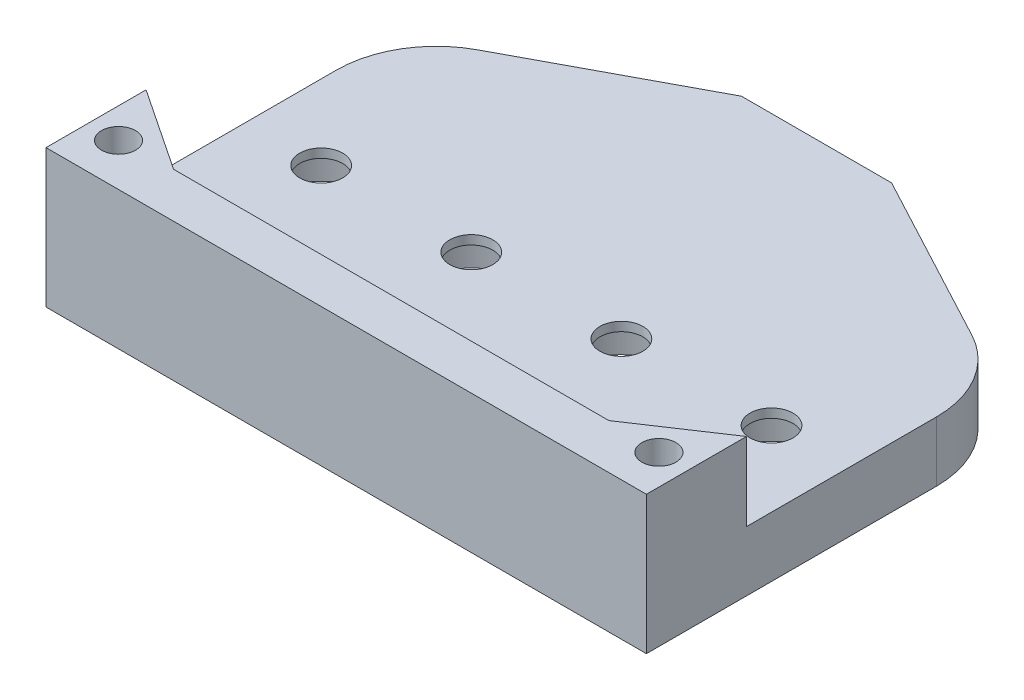
from build123d import *

# Parameters (mm, degrees)
SKETCH2_R           = 2.15
BOSS_EXTRUDE1_DEPTH = 6
BOSS_EXTRUDE2_DEPTH = 7.8
SKETCH4_R           = 1.7
CUT_EXTRUDE1_DEPTH  = 78.456052055
SKETCH5_R           = 6.55
CUT_EXTRUDE2_DEPTH  = 5.1
FILLET1_R           = 10
SKETCH6_R           = 2.6
CUT_EXTRUDE3_DEPTH  = 5


with BuildPart() as part:
    # Sketch2 → Boss-Extrude1 (new body)
    with BuildSketch(Plane(origin=(0, 0, 0), x_dir=(1, 0, 0), z_dir=(0, 1, 0))):
        Polygon((0, 0), (0, 35), (22.5, 47), (37.5, 47), (60, 35), (60, 0), align=None)
        with Locations((7.5, 20)):
            Circle(SKETCH2_R, mode=Mode.SUBTRACT)
        with Locations((22.5, 20)):
            Circle(SKETCH2_R, mode=Mode.SUBTRACT)
        with Locations((37.5, 20)):
            Circle(SKETCH2_R, mode=Mode.SUBTRACT)
        with Locations((52.5, 20)):
            Circle(SKETCH2_R, mode=Mode.SUBTRACT)
    extrude(amount=BOSS_EXTRUDE1_DEPTH)

    # Sketch3 → Boss-Extrude2 (add)
    with BuildSketch(Plane(origin=(0, 6, 0), x_dir=(1, 0, 0), z_dir=(0, 1, 0))):
        Polygon((0, 10), (0, 0), (60, 0), (60, 10), (51.75, 4.5), (8.25, 4.5), align=None)
    extrude(amount=BOSS_EXTRUDE2_DEPTH)

    # Sketch4 → Cut-Extrude1 (cut, through all)
    with BuildSketch(Plane(origin=(0, 13.8, 0), x_dir=(1, 0, 0), z_dir=(0, 1, 0))):
        with Locations((3, 4.25)):
            Circle(SKETCH4_R)
        with Locations((57, 4.25)):
            Circle(SKETCH4_R)
    extrude(amount=-CUT_EXTRUDE1_DEPTH, mode=Mode.SUBTRACT)

    # Sketch5 → Cut-Extrude2 (cut)
    with BuildSketch(Plane(origin=(0, 0, 0), x_dir=(1, 0, 0), z_dir=(0, 1, 0))):
        with Locations((7.5, 20)):
            Circle(SKETCH5_R)
        with Locations((22.5, 20)):
            Circle(SKETCH5_R)
        with Locations((37.5, 20)):
            Circle(SKETCH5_R)
        with Locations((52.5, 20)):
            Circle(SKETCH5_R)
    extrude(amount=CUT_EXTRUDE2_DEPTH, mode=Mode.SUBTRACT)

    # Fillet1
    fillet1_edges = [part.edges().sort_by_distance(p)[0] for p in [
        (0, 3, -35),
        (60, 3, -35),
    ]]
    fillet(fillet1_edges, radius=FILLET1_R)

    # Sketch6 → Cut-Extrude3 (cut)
    with BuildSketch(Plane(origin=(0, 0, 0), x_dir=(-1, 0, 0), z_dir=(0, -1, 0))):
        with Locations((-25, 42.25)):
            Circle(SKETCH6_R)
        with Locations((-35, 42.25)):
            Circle(SKETCH6_R)
        with Locations((-35, 4.25)):
            Circle(SKETCH6_R)
        with Locations((-25, 4.25)):
            Circle(SKETCH6_R)
    extrude(amount=-CUT_EXTRUDE3_DEPTH, mode=Mode.SUBTRACT)


solid = part.part
